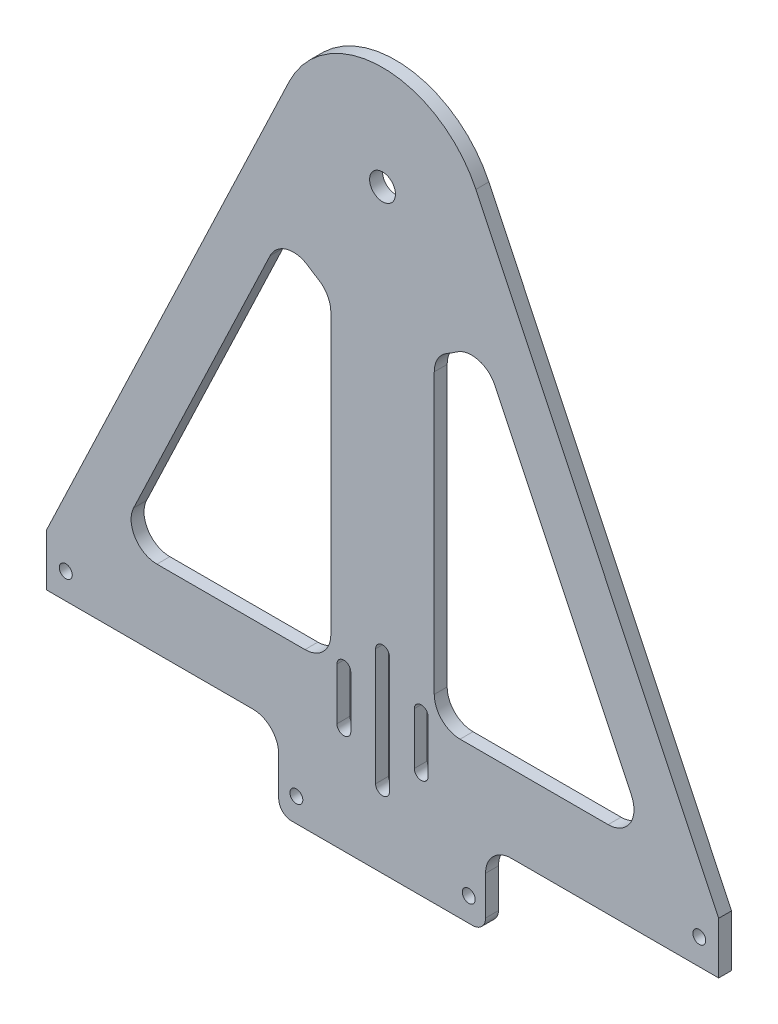
from build123d import *

# Parameters (mm, degrees)
SKETCH5_R           = 1.5875
SKETCH5_R_2         = 3.175
BOSS_EXTRUDE2_DEPTH = 3.175


with BuildPart() as part:
    # Sketch5 → Boss-Extrude2 (new body)
    with BuildSketch(Plane.XY):
        with BuildLine():
            Line((-82.55, 58.42), (-82.55, 45.72))
            Line((-82.55, 45.72), (-31.848963051, 45.72))
            ThreePointArc((-31.848963051, 45.72), (-27.35883499, 43.860128061), (-25.498963051, 39.37))
            Line((-25.498963051, 39.37), (-25.498963051, 29.845))
            ThreePointArc((-25.498963051, 29.845), (-24.569027081, 27.59993597), (-22.323963051, 26.67))
            Line((-22.323963051, 26.67), (22.126036949, 26.67))
            ThreePointArc((22.126036949, 26.67), (24.37110098, 27.59993597), (25.301036949, 29.845))
            Line((25.301036949, 29.845), (25.301036949, 39.37))
            ThreePointArc((25.301036949, 39.37), (27.160908889, 43.860128061), (31.651036949, 45.72))
            Line((31.651036949, 45.72), (82.55, 45.72))
            Line((82.55, 45.72), (82.55, 58.42))
            Line((82.55, 58.42), (22.933465972, 183.638614313))
            ThreePointArc((22.933465972, 183.638614313), (0, 198.12), (-22.933465972, 183.638614313))
            Line((-22.933465972, 183.638614313), (-82.55, 58.42))
        make_face()
        with Locations((-77.7875, 52.07)):
            Circle(SKETCH5_R, mode=Mode.SUBTRACT)
        with Locations((77.7875, 52.07)):
            Circle(SKETCH5_R, mode=Mode.SUBTRACT)
        with Locations((-21.166666667, 32.503356634)):
            Circle(SKETCH5_R, mode=Mode.SUBTRACT)
        with Locations((21.166666667, 32.503356634)):
            Circle(SKETCH5_R, mode=Mode.SUBTRACT)
        with Locations((0, 172.72)):
            Circle(SKETCH5_R_2, mode=Mode.SUBTRACT)
        with BuildLine():
            Line((-61.138040857, 73.849653578), (-27.615581335, 144.260253558))
            ThreePointArc((-27.615581335, 144.260253558), (-23.498279642, 147.671514779), (-18.235179035, 146.728833317))
            ThreePointArc((-18.235179035, 146.728833317), (-17.071685329, 145.950239821), (-15.875, 145.22369343))
            ThreePointArc((-15.875, 145.22369343), (-13.550738686, 142.899432116), (-12.7, 139.724432116))
            Line((-12.7, 139.724432116), (-12.7, 71.12))
            ThreePointArc((-12.7, 71.12), (-14.559871939, 66.629871939), (-19.05, 64.77))
            Line((-19.05, 64.77), (-55.404674364, 64.77))
            ThreePointArc((-55.404674364, 64.77), (-60.77383632, 67.729631305), (-61.138040857, 73.849653578))
        make_face(mode=Mode.SUBTRACT)
        with BuildLine():
            Line((61.138040857, 73.849653578), (27.615581335, 144.260253558))
            ThreePointArc((27.615581335, 144.260253558), (23.498279642, 147.671514779), (18.235179035, 146.728833317))
            ThreePointArc((18.235179035, 146.728833317), (17.071685329, 145.950239821), (15.875, 145.22369343))
            ThreePointArc((15.875, 145.22369343), (13.550738686, 142.899432116), (12.7, 139.724432116))
            Line((12.7, 139.724432116), (12.7, 71.12))
            ThreePointArc((12.7, 71.12), (14.559871939, 66.629871939), (19.05, 64.77))
            Line((19.05, 64.77), (55.404674364, 64.77))
            ThreePointArc((55.404674364, 64.77), (60.77383632, 67.729631305), (61.138040857, 73.849653578))
        make_face(mode=Mode.SUBTRACT)
        with BuildLine():
            Line((-11.2, 52.915063076), (-11.2, 65.615063076))
            ThreePointArc((-11.2, 65.615063076), (-9.5, 67.315063076), (-7.8, 65.615063076))
            Line((-7.8, 65.615063076), (-7.8, 52.915063076))
            ThreePointArc((-7.8, 52.915063076), (-9.5, 51.215063076), (-11.2, 52.915063076))
        make_face(mode=Mode.SUBTRACT)
        with BuildLine():
            Line((-1.7, 44.915063076), (-1.7, 73.615063076))
            ThreePointArc((-1.7, 73.615063076), (0, 75.315063076), (1.7, 73.615063076))
            Line((1.7, 73.615063076), (1.7, 44.915063076))
            ThreePointArc((1.7, 44.915063076), (0, 43.215063076), (-1.7, 44.915063076))
        make_face(mode=Mode.SUBTRACT)
        with BuildLine():
            Line((7.8, 52.915063076), (7.8, 65.615063076))
            ThreePointArc((7.8, 65.615063076), (9.5, 67.315063076), (11.2, 65.615063076))
            Line((11.2, 65.615063076), (11.2, 52.915063076))
            ThreePointArc((11.2, 52.915063076), (9.5, 51.215063076), (7.8, 52.915063076))
        make_face(mode=Mode.SUBTRACT)
    extrude(amount=BOSS_EXTRUDE2_DEPTH)


solid = part.part
